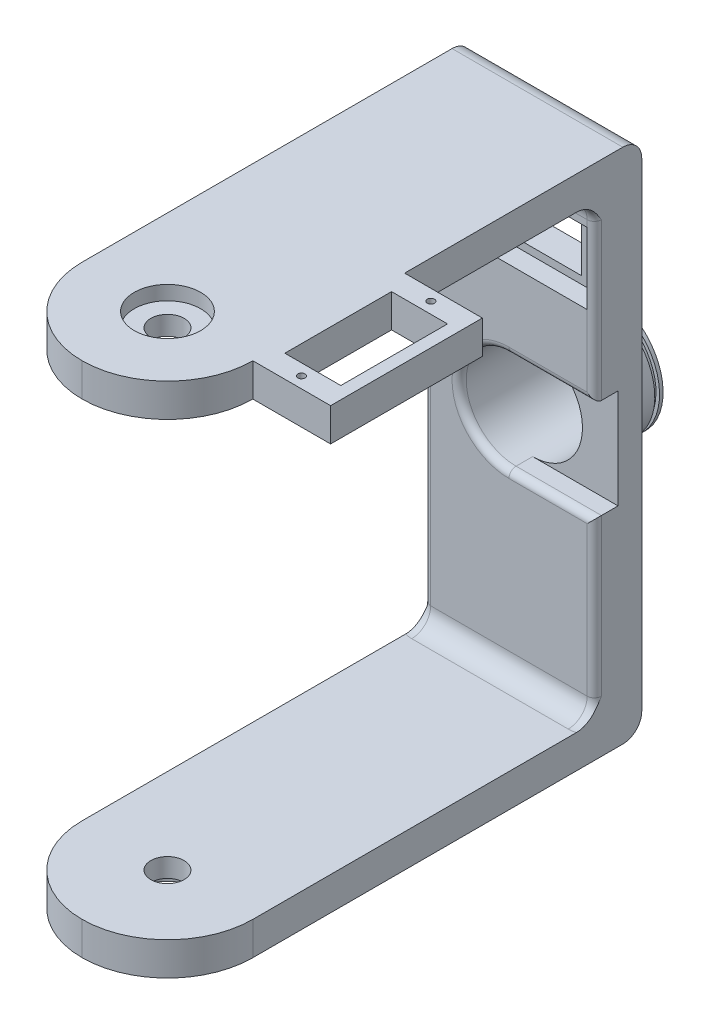
from build123d import *

# Parameters (mm, degrees)
SKETCH1_W               = 109
SKETCH1_H               = 36
BOSS_EXTRUDE1_DEPTH     = 10
SKETCH2_W               = 36
SKETCH2_H               = 7
BOSS_EXTRUDE2_DEPTH     = 90
CUT_EXTRUDE1_DEPTH      = 150.013422214
CUT_EXTRUDE1_DEPTH_BACK = 150.013422214
SKETCH3_R               = 3.5
CUT_EXTRUDE2_DEPTH      = 150.013422214
CUT_EXTRUDE2_DEPTH_BACK = 3
SKETCH4_R               = 7
CUT_EXTRUDE3_START      = -3
SKETCH5_R               = 7
CUT_EXTRUDE3_DEPTH      = 3
FILLET1_R               = 18
SKETCH6_R               = 12.5
BOSS_EXTRUDE3_DEPTH     = 10
SKETCH15_R              = 13.75
BOSS_EXTRUDE5_DEPTH     = 4.25
SKETCH7_R               = 10.5
CUT_EXTRUDE4_DEPTH      = 125.073566887
SKETCH9_R               = 0.75
SKETCH9_W               = 22.5
SKETCH9_H               = 11.8
CUT_EXTRUDE5_DEPTH      = 107.743852282
SKETCH10_W              = 33
SKETCH10_H              = 15
CUT_EXTRUDE6_DEPTH      = 4
SKETCH11_W              = 17
SKETCH11_H              = 32
BOSS_EXTRUDE4_DEPTH     = 7
CUT_EXTRUDE7_REACH      = 153.869
SKETCH12_R              = 0.75
SKETCH12_W              = 11.8
SKETCH12_H              = 22.5
CUT_EXTRUDE8_START      = -5
CUT_EXTRUDE8_DEPTH      = 5
FILLET3_R               = 1.5
FILLET4_R               = 4
SKETCH14_W              = 1.25
SKETCH14_H              = 1
FILLET5_R               = 1


# Some blends are built 0.0001 mm under size
with BuildPart() as part:
    # Sketch1 → Boss-Extrude1 (new body)
    with BuildSketch(Plane(origin=(0, 0, 0), x_dir=(0, 1, 0), z_dir=(0, 0, 1))):
        Rectangle(SKETCH1_W, SKETCH1_H)
    extrude(amount=BOSS_EXTRUDE1_DEPTH)

    # Sketch2 → Boss-Extrude2 (add)
    with BuildSketch(Plane.XY.offset(10)):
        with Locations((0, 51)):
            Rectangle(SKETCH2_W, SKETCH2_H)
        with Locations((0, -51)):
            Rectangle(SKETCH2_W, SKETCH2_H)
    extrude(amount=BOSS_EXTRUDE2_DEPTH)

    # Sketch3 → Cut-Extrude1 (cut, two sides: drawn at the far end of the back side and taken through both)
    with BuildSketch(Plane.XZ.offset(54.5).offset(-CUT_EXTRUDE1_DEPTH_BACK)):
        with Locations(Location((0, 82, 0), (0, 0, 270))):
            Circle(SKETCH3_R)
    extrude(amount=CUT_EXTRUDE1_DEPTH + CUT_EXTRUDE1_DEPTH_BACK, mode=Mode.SUBTRACT)

    # Sketch4 → Cut-Extrude2 (cut, two sides: drawn at the far end of the back side and taken through both)
    with BuildSketch(Plane.XZ.offset(54.5).offset(-CUT_EXTRUDE2_DEPTH_BACK)):
        with Locations(Location((0, 82, 0), (0, 0, 90))):
            Circle(SKETCH4_R)
    extrude(amount=CUT_EXTRUDE2_DEPTH + CUT_EXTRUDE2_DEPTH_BACK, mode=Mode.SUBTRACT)

    # Sketch5 → Cut-Extrude3 (cut)
    with BuildSketch(Plane(origin=(0, 54.5, 0), x_dir=(-1, 0, 0), z_dir=(0, 1, 0)).offset(CUT_EXTRUDE3_START)):
        with Locations(Location((0, 82, 0), (0, 0, 90))):
            Circle(SKETCH5_R)
    extrude(amount=CUT_EXTRUDE3_DEPTH, mode=Mode.SUBTRACT)

    # Fillet1
    fillet1_edges = [part.edges().sort_by_distance(p)[0] for p in [
        (18, -51, 100),
        (-18, -51, 100),
        (18, 51, 100),
        (-18, 51, 100),
    ]]
    fillet(fillet1_edges, radius=FILLET1_R - 0.0001)  # a hair under: the kernel refuses the full size

    # Sketch6 → Boss-Extrude3 (add)
    with BuildSketch(Plane(origin=(0, 0, 0), x_dir=(1, 0, 0), z_dir=(0, 0, -1))):
        with Locations(Location((0, 0, 0), (0, 0, 180))):
            Circle(SKETCH6_R)
    extrude(amount=BOSS_EXTRUDE3_DEPTH)

    # Sketch15 → Boss-Extrude5 (add)
    with BuildSketch(Plane(origin=(0, 0, 0), x_dir=(1, 0, 0), z_dir=(0, 0, -1))):
        with Locations(Location((0, 0, 0), (0, 0, 180))):
            Circle(SKETCH15_R)
    extrude(amount=BOSS_EXTRUDE5_DEPTH)

    # Sketch7 → Cut-Extrude4 (cut, through all)
    with BuildSketch(Plane(origin=(0, 0, -10), x_dir=(1, 0, 0), z_dir=(0, 0, -1))):
        with Locations(Location((0, 0, 0), (0, 0, 180))):
            Circle(SKETCH7_R)
    extrude(amount=-CUT_EXTRUDE4_DEPTH, mode=Mode.SUBTRACT)

    # Sketch9 → Cut-Extrude5 (cut, through all)
    with BuildSketch(Plane.XY.offset(10)):
        with Locations((-13.65, 34.588690348)):
            Circle(SKETCH9_R)
        with Locations((13.65, 34.588690348)):
            Circle(SKETCH9_R)
        with Locations((0, 34.588690348)):
            Rectangle(SKETCH9_W, SKETCH9_H)
    extrude(amount=-CUT_EXTRUDE5_DEPTH, mode=Mode.SUBTRACT)

    # Sketch10 → Cut-Extrude6 (cut)
    with BuildSketch(Plane.XY.offset(10)):
        with Locations((0, 34.588690348)):
            Rectangle(SKETCH10_W, SKETCH10_H)
    extrude(amount=-CUT_EXTRUDE6_DEPTH, mode=Mode.SUBTRACT)

    # Sketch11 → Boss-Extrude4 (add)
    with BuildSketch(Plane(origin=(0, 54.5, 0), x_dir=(-1, 0, 0), z_dir=(0, 1, 0))):
        with Locations((-25.895511194, 66)):
            Rectangle(SKETCH11_W, SKETCH11_H)
    extrude(amount=-BOSS_EXTRUDE4_DEPTH)

    # Sketch12 → Cut-Extrude7 (cut, up to next)
    with BuildSketch(Plane(origin=(0, 54.5, 0), x_dir=(-1, 0, 0), z_dir=(0, 1, 0)), mode=Mode.PRIVATE) as cut_extrude7_sk1:
        with Locations(Location((-25.895511194, 79.65, 0), (0, 0, 90))):
            Circle(SKETCH12_R)
    cut_extrude7_tool1 = extrude(cut_extrude7_sk1.sketch, amount=-CUT_EXTRUDE7_REACH, mode=Mode.PRIVATE) & part.part
    # Sketch12 → Cut-Extrude7 (cut, up to next)
    with BuildSketch(Plane(origin=(0, 54.5, 0), x_dir=(-1, 0, 0), z_dir=(0, 1, 0)), mode=Mode.PRIVATE) as cut_extrude7_sk2:
        with Locations((-25.895511194, 52.35)):
            Circle(SKETCH12_R)
    cut_extrude7_tool2 = extrude(cut_extrude7_sk2.sketch, amount=-CUT_EXTRUDE7_REACH, mode=Mode.PRIVATE) & part.part
    # Sketch12 → Cut-Extrude7 (cut, up to next)
    with BuildSketch(Plane(origin=(0, 54.5, 0), x_dir=(-1, 0, 0), z_dir=(0, 1, 0)), mode=Mode.PRIVATE) as cut_extrude7_sk3:
        with Locations((-25.895511194, 66)):
            Rectangle(SKETCH12_W, SKETCH12_H)
    cut_extrude7_tool3 = extrude(cut_extrude7_sk3.sketch, amount=-CUT_EXTRUDE7_REACH, mode=Mode.PRIVATE) & part.part
    add(cut_extrude7_tool1.solids().sort_by_distance((25.895511, 54.5, 79.65))[0], mode=Mode.SUBTRACT)
    add(cut_extrude7_tool2.solids().sort_by_distance((25.895511, 54.5, 52.35))[0], mode=Mode.SUBTRACT)
    add(cut_extrude7_tool3.solids().sort_by_distance((25.895511, 54.5, 66))[0], mode=Mode.SUBTRACT)

    # Sketch13 → Cut-Extrude8 (cut)
    with BuildSketch(Plane.XY.offset(10).offset(CUT_EXTRUDE8_START)):
        with BuildLine():
            Line((18, -10.5), (18, 10.5))
            Line((18, 10.5), (0, 10.5))
            ThreePointArc((0, 10.5), (10.5, 0), (0, -10.5))
            Line((0, -10.5), (18, -10.5))
        make_face()
    extrude(amount=CUT_EXTRUDE8_DEPTH, mode=Mode.SUBTRACT)

    # Fillet3
    fillet3_edges = [part.edges().sort_by_distance(p)[0] for p in [
        (-18, 0, 10),
        (18, -29, 10),
        (-7.424621202, 7.424621202, 10),
        (18, 29, 10),
        (9, -10.5, 10),
        (9, 10.5, 10),
    ]]
    fillet(fillet3_edges, radius=FILLET3_R - 0.0001)  # a hair under: the kernel refuses the full size

    # Fillet4
    # the kernel refuses this fillet: 4 mm, written as the material it adds along each edge
    with BuildSketch(Plane(origin=(16.5001, 47.5, 10), x_dir=(0, -1, 0), z_dir=(-1, 0, 0))) as fillet4_piece_1:
        with BuildLine():
            CenterArc((FILLET4_R, FILLET4_R), FILLET4_R, 180, 90)
            Line((0, FILLET4_R), (0, 0))
            Line((0, 0), (FILLET4_R, 0))
        make_face()
    extrude(amount=33.0002)
    with BuildSketch(Plane(origin=(16.5001, -47.5, 10), x_dir=(0, 1, 0), z_dir=(-1, 0, 0))) as fillet4_piece_2:
        with BuildLine():
            CenterArc((FILLET4_R, -FILLET4_R), FILLET4_R, 90, 90)
            Line((0, -FILLET4_R), (0, 0))
            Line((0, 0), (FILLET4_R, 0))
        make_face()
    extrude(amount=33.0002)
    with BuildSketch(Plane(origin=(-16.5001, -47.5, 8.5001), x_dir=(0, 0, 1), z_dir=(1, 0, 0))) as fillet4_piece_3_section:
        with BuildLine():
            CenterArc((1.4999 + FILLET4_R, -FILLET4_R), FILLET4_R, 90, 90)
            Line((1.4999 + FILLET4_R, 0), (1.4999, 0))
            Line((1.4999, 0), (1.4999, -FILLET4_R))
        make_face()
    fillet4_piece_3 = revolve(axis=Axis((-16.5001, -47.5, 8.5001), (0, -1, 0)), revolution_arc=359.64, mode=Mode.PRIVATE)
    fillet4_piece_3 = split(fillet4_piece_3, bisect_by=Plane(origin=(-18, -46.011467158, 9.644627934), z_dir=(1, 0, 0)), keep=Keep.TOP, mode=Mode.PRIVATE)
    add(fillet4_piece_3)
    with BuildSketch(Plane(origin=(-16.5001, 47.5, 8.5001), x_dir=(0, 0, 1), z_dir=(1, 0, 0))) as fillet4_piece_4_section:
        with BuildLine():
            CenterArc((1.4999 + FILLET4_R, FILLET4_R), FILLET4_R, 180, 90)
            Line((1.4999 + FILLET4_R, 0), (1.4999, 0))
            Line((1.4999, 0), (1.4999, FILLET4_R))
        make_face()
    fillet4_piece_4 = revolve(axis=Axis((-16.5001, 47.5, 8.5001), (0, -1, 0)), revolution_arc=359.64, mode=Mode.PRIVATE)
    fillet4_piece_4 = split(fillet4_piece_4, bisect_by=Plane(origin=(-18, 46.011467158, 9.644627939), z_dir=(1, 0, 0)), keep=Keep.TOP, mode=Mode.PRIVATE)
    add(fillet4_piece_4)
    with BuildSketch(Plane(origin=(16.5001, -47.5, 8.5001), x_dir=(-0.006283143965559021, 0, 0.9999802608561371), z_dir=(0.9999802608561371, 0, 0.006283143965559021))) as fillet4_piece_5_section:
        with BuildLine():
            CenterArc((-1.4999 - FILLET4_R, -FILLET4_R), FILLET4_R, 0, 90)
            Line((-1.4999 - FILLET4_R, 0), (-1.4999, 0))
            Line((-1.4999, 0), (-1.4999, -FILLET4_R))
        make_face()
    fillet4_piece_5 = revolve(axis=Axis((16.5001, -47.5, 8.5001), (0, -1, 0)), revolution_arc=359.64, mode=Mode.PRIVATE)
    fillet4_piece_5 = split(fillet4_piece_5, bisect_by=Plane(origin=(18, -46.011467161, 9.644627937), z_dir=(-1, 0, 0)), keep=Keep.TOP, mode=Mode.PRIVATE)
    add(fillet4_piece_5)
    with BuildSketch(Plane(origin=(16.5001, 47.5, 8.5001), x_dir=(-0.006283143965559021, 0, 0.9999802608561371), z_dir=(0.9999802608561371, 0, 0.006283143965559021))) as fillet4_piece_6_section:
        with BuildLine():
            CenterArc((-1.4999 - FILLET4_R, FILLET4_R), FILLET4_R, 270, 90)
            Line((-1.4999, FILLET4_R), (-1.4999, 0))
            Line((-1.4999, 0), (-1.4999 - FILLET4_R, 0))
        make_face()
    fillet4_piece_6 = revolve(axis=Axis((16.5001, 47.5, 8.5001), (0, -1, 0)), revolution_arc=359.64, mode=Mode.PRIVATE)
    fillet4_piece_6 = split(fillet4_piece_6, bisect_by=Plane(origin=(18, 46.011467202, 9.644627972), z_dir=(-1, 0, 0)), keep=Keep.TOP, mode=Mode.PRIVATE)
    add(fillet4_piece_6)
    # the kernel refuses this fillet: 4 mm, written as the material it takes off along each edge
    with BuildSketch(Plane(origin=(-28, -54.5, 0), x_dir=(0, 0, 1), z_dir=(1, 0, 0))) as fillet4_2_piece_1:
        with BuildLine():
            CenterArc((FILLET4_R, -FILLET4_R), FILLET4_R, 90, 90)
            Line((0, -FILLET4_R), (0, 0))
            Line((0, 0), (FILLET4_R, 0))
        make_face()
    extrude(amount=56, mode=Mode.SUBTRACT)
    with BuildSketch(Plane(origin=(28, 54.5, 0), x_dir=(0, -1, 0), z_dir=(-1, 0, 0))) as fillet4_2_piece_2:
        with BuildLine():
            CenterArc((FILLET4_R, FILLET4_R), FILLET4_R, 180, 90)
            Line((0, FILLET4_R), (0, 0))
            Line((0, 0), (FILLET4_R, 0))
        make_face()
    extrude(amount=56, mode=Mode.SUBTRACT)

    # Sketch14 → Cut-Revolve1 (revolve, cut)
    with BuildSketch(Plane.YZ, mode=Mode.PRIVATE) as cut_revolve1_sk:
        with Locations((-12.375, -8.75)):
            Rectangle(SKETCH14_W, SKETCH14_H)
    revolve(cut_revolve1_sk.sketch.rotate(Axis((0, 0, -10), (0, 0, 1)), 180), axis=Axis((0, 0, -10), (0, 0, 1)), mode=Mode.SUBTRACT)

    # Fillet5
    fillet5_edges = [part.edges().sort_by_distance(p)[0] for p in [
        (13.75, 0, 0),
    ]]
    fillet(fillet5_edges, radius=FILLET5_R)


solid = part.part
